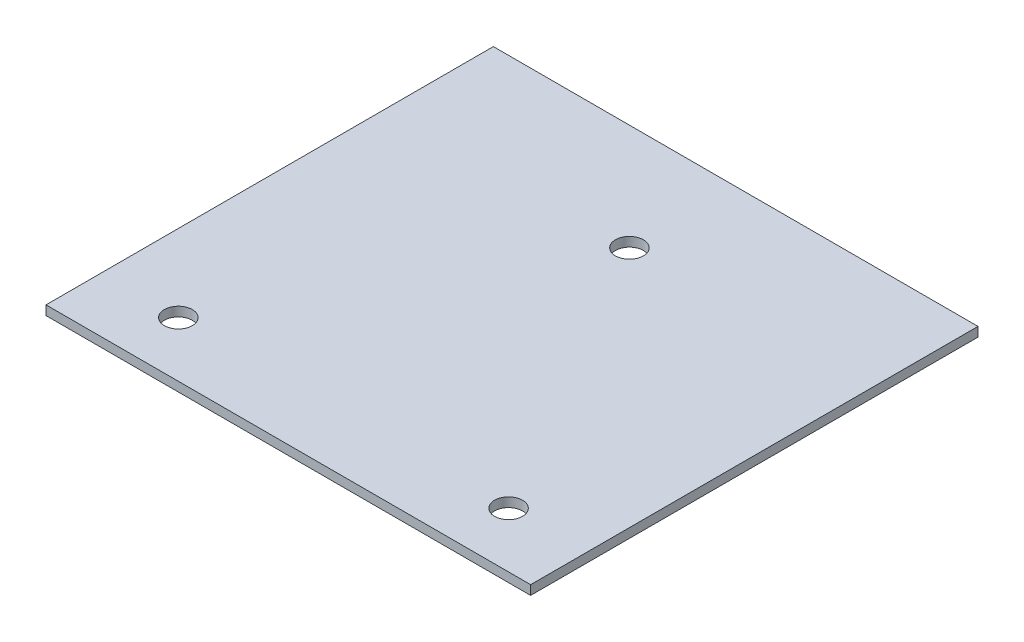
from build123d import *

# Parameters (mm, degrees)
SKETCH1_W           = 660.4
SKETCH1_H           = 609.6
BOSS_EXTRUDE1_DEPTH = 12.7
SKETCH5_R           = 19.05
CUT_EXTRUDE2_DEPTH  = 899.833471784


with BuildPart() as part:
    # Sketch1 → Boss-Extrude1 (new body)
    with BuildSketch(Plane(origin=(0, 0, 0), x_dir=(1, 0, 0), z_dir=(0, 1, 0))):
        with Locations((330.2, 304.8)):
            Rectangle(SKETCH1_W, SKETCH1_H)
    extrude(amount=BOSS_EXTRUDE1_DEPTH)

    # Sketch5 → Cut-Extrude2 (cut, through all)
    with BuildSketch(Plane(origin=(0, 12.7, 0), x_dir=(1, 0, 0), z_dir=(0, 1, 0))):
        with Locations((105.2, 75.116646637)):
            Circle(SKETCH5_R)
        with Locations((555.2, 75.116646637)):
            Circle(SKETCH5_R)
        with Locations((330.2, 464.82807834)):
            Circle(SKETCH5_R)
    extrude(amount=-CUT_EXTRUDE2_DEPTH, mode=Mode.SUBTRACT)


solid = part.part
